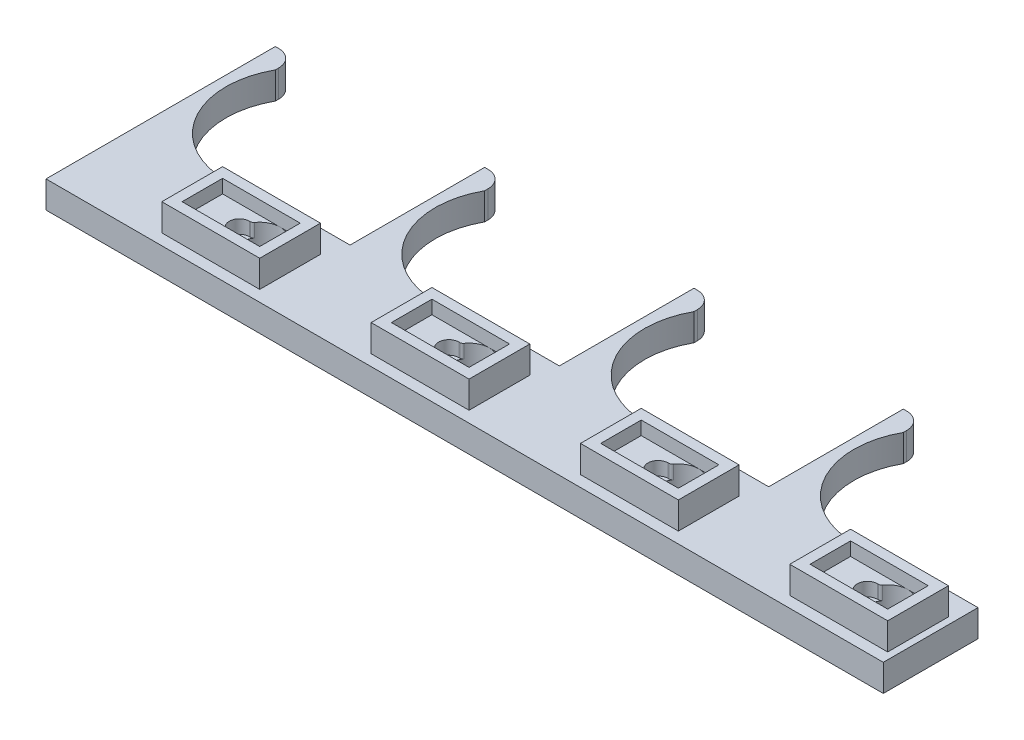
from build123d import *

# Parameters (mm, degrees)
ESQUISSE1_R                = 6
BOSS_EXTRU_1_DEPTH         = 8
ESQUISSE2_W                = 29
ESQUISSE2_H                = 18
BOSS_EXTRU_2_DEPTH         = 4
ESQUISSE3_W                = 29
ESQUISSE3_H                = 18
ESQUISSE3_W_2              = 23
ESQUISSE3_H_2              = 12
BOSS_EXTRU_3_DEPTH         = 4
ENL_V_MAT_EXTRU_1_DEPTH    = 4
R_P_TITION_LIN_AIRE1_COUNT = 4
R_P_TITION_LIN_AIRE1_PITCH = 62


with BuildPart() as part:
    # Esquisse1 → Boss.-Extru.1 (new body)
    with BuildSketch(Plane(origin=(0, 0, 0), x_dir=(1, 0, 0), z_dir=(0, 1, 0))):
        with BuildLine():
            Line((0, 0), (6, 0))
            Line((6, 0), (36, 0))
            Line((36, 0), (62, 0))
            Line((62, 0), (62, 28.055987731))
            Line((62, 28.055987731), (36, 28.055987731))
            ThreePointArc((36, 28.055987731), (9.034681758, 34.39083629), (6, 61.923533231))
            Line((6, 61.923533231), (6, 62.923533231))
            ThreePointArc((6, 62.923533231), (4.535533906, 66.459067137), (1, 67.923533231))
            Line((1, 67.923533231), (0, 67.923533231))
            Line((0, 67.923533231), (0, 0))
        make_face()
        with Locations((51, 12.304583192)):
            Circle(ESQUISSE1_R, mode=Mode.SUBTRACT)
    extrude(amount=BOSS_EXTRU_1_DEPTH)

    # Esquisse2 → Boss.-Extru.2 (add)
    with BuildSketch(Plane(origin=(0, 8, 0), x_dir=(1, 0, 0), z_dir=(0, 1, 0))):
        with Locations((45.5, 12.304583192)):
            Rectangle(ESQUISSE2_W, ESQUISSE2_H)
        with BuildLine():
            Line((45, 15.304583192), (45.255437353, 15.304583192))
            ThreePointArc((45.255437353, 15.304583192), (45.718347403, 15.418177932), (46.07608916, 15.733154621))
            ThreePointArc((46.07608916, 15.733154621), (57, 12.304583192), (46.07608916, 8.876011764))
            ThreePointArc((46.07608916, 8.876011764), (45.718347403, 9.190988453), (45.255437353, 9.304583192))
            Line((45.255437353, 9.304583192), (45, 9.304583192))
            ThreePointArc((45, 9.304583192), (42, 12.304583192), (45, 15.304583192))
        make_face(mode=Mode.SUBTRACT)
    extrude(amount=BOSS_EXTRU_2_DEPTH)

    # Esquisse3 → Boss.-Extru.3 (add)
    with BuildSketch(Plane(origin=(0, 12, 0), x_dir=(1, 0, 0), z_dir=(0, 1, 0))):
        with Locations((45.5, 12.304583192)):
            Rectangle(ESQUISSE3_W, ESQUISSE3_H)
        with Locations((45.5, 12.304583192)):
            Rectangle(ESQUISSE3_W_2, ESQUISSE3_H_2, mode=Mode.SUBTRACT)
    extrude(amount=BOSS_EXTRU_3_DEPTH)

    # Esquisse4 → Enlèv. mat.-Extru.1 (cut)
    with BuildSketch(Plane.XZ):
        Polygon((47.7, -17.055987731), (54.3, -17.055987731), (55.193703609, -16.162284122), (57.721788353, -28.055987731), (54.3, -28.055987731), (47.7, -28.055987731), (44.278211647, -28.055987731), (46.806296391, -16.162284122), align=None)
    extrude(amount=-ENL_V_MAT_EXTRU_1_DEPTH, mode=Mode.SUBTRACT)

    # Répétition linéaire1: part ×4


with BuildPart() as part_1:
    add(part.part)
    with Locations(*[(i * R_P_TITION_LIN_AIRE1_PITCH, 0, 0) for i in range(1, R_P_TITION_LIN_AIRE1_COUNT)]):
        add(part.part)


solid = part_1.part
